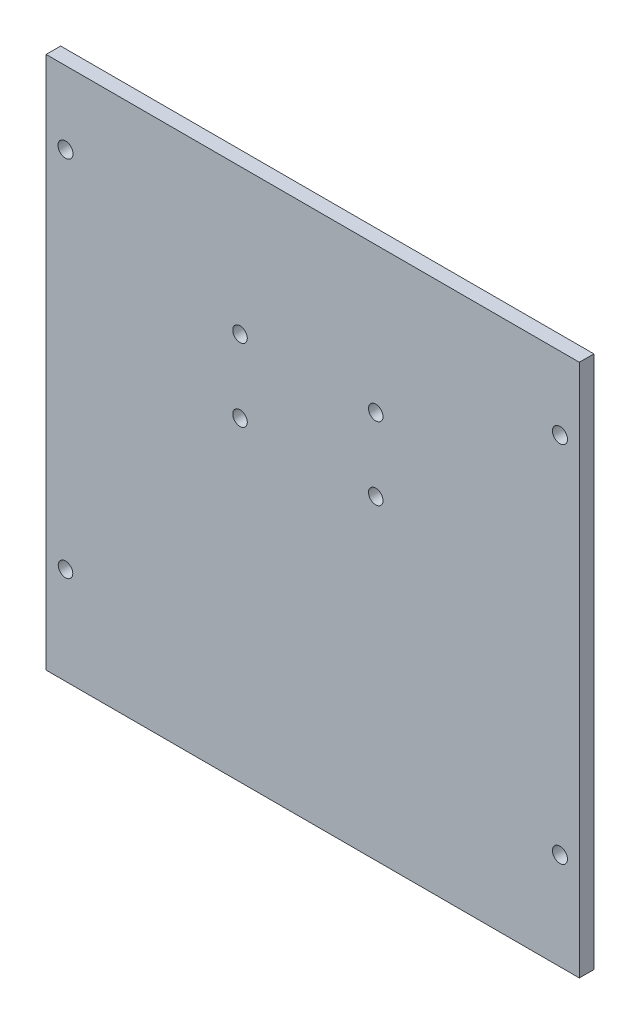
from build123d import *

# Parameters (mm, degrees)
SKETCH_1_W          = 110
SKETCH_1_H          = 110
EXTRUDE_1_DEPTH     = 3
SKETCH_2_R          = 1.5
CUT_EXTRUDE_1_DEPTH = 10
SKETCH_3_R          = 1.55
SKETCH_3_R_2        = 1.5
CUT_EXTRUDE_2_DEPTH = 10


with BuildPart() as part:
    # 草图1 → 凸台-拉伸1 (new body)
    with BuildSketch(Plane.XY):
        Rectangle(SKETCH_1_W, SKETCH_1_H)
    extrude(amount=EXTRUDE_1_DEPTH)

    # 草图2 → 切除-拉伸1 (cut)
    with BuildSketch(Plane(origin=(0, 0, 0), x_dir=(-1, 0, 0), z_dir=(0, 0, -1))):
        with Locations((-13, 10.02)):
            Circle(SKETCH_2_R)
        with Locations((-13, 25.02)):
            Circle(SKETCH_2_R)
        with Locations((15, 10.02)):
            Circle(SKETCH_2_R)
        with Locations((15, 25.02)):
            Circle(SKETCH_2_R)
    extrude(amount=-CUT_EXTRUDE_1_DEPTH, mode=Mode.SUBTRACT)

    # 草图3 → 切除-拉伸2 (cut)
    with BuildSketch(Plane(origin=(0, 0, 0), x_dir=(-1, 0, 0), z_dir=(0, 0, -1))):
        with Locations((-51, -35)):
            Circle(SKETCH_3_R)
        with Locations((-51, 40)):
            Circle(SKETCH_3_R)
        with Locations((51, -35)):
            Circle(SKETCH_3_R_2)
        with Locations((51, 40)):
            Circle(SKETCH_3_R)
    extrude(amount=-CUT_EXTRUDE_2_DEPTH, mode=Mode.SUBTRACT)


solid = part.part
